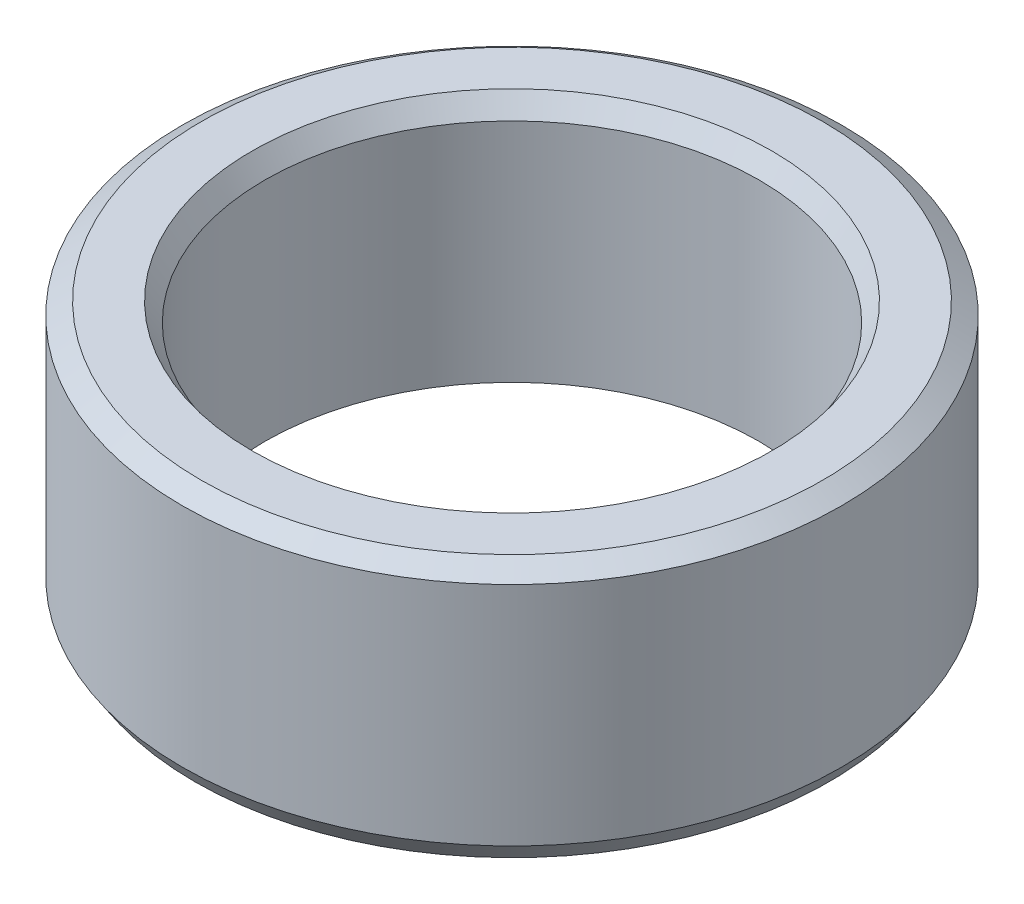
from build123d import *
from OCP.BRepFilletAPI import BRepFilletAPI_MakeChamfer

# Parameters (mm, degrees)
SKETCH1_R           = 45
BOSS_EXTRUDE1_DEPTH = 35.206088782
SKETCH2_R           = 33.75129709
CUT_EXTRUDE1_DEPTH  = 73.728733574
CHAMFER1_SIZE       = 1.714017891
CHAMFER1_SIZE2      = 2.590154728


with BuildPart() as part:
    # Sketch1 → Boss-Extrude1 (new body)
    with BuildSketch(Plane(origin=(0, 0, 0), x_dir=(1, 0, 0), z_dir=(0, 1, 0))):
        Circle(SKETCH1_R)
    extrude(amount=BOSS_EXTRUDE1_DEPTH)

    # Sketch2 → Cut-Extrude1 (cut, through all)
    with BuildSketch(Plane(origin=(0, 0, 0), x_dir=(1, 0, 0), z_dir=(0, 1, 0))):
        Circle(SKETCH2_R)
    extrude(amount=CUT_EXTRUDE1_DEPTH, mode=Mode.SUBTRACT)

    # Chamfer1: one chamfer whose edges measure the first distance from different faces: ONE call of the kernel's chamfer builder (chamfer() names one face for all edges)
    chamfer1_edges_1 = [part.edges().sort_by_distance(p)[0] for p in [
        (-33.75129709, 35.206088782, 0),
    ]]
    chamfer1_side_1 = [part.faces().sort_by_distance(p)[0] for p in [
        (-43.727207794, 35.206088782, 0),
    ]]
    chamfer1_edges_2 = [part.edges().sort_by_distance(p)[0] for p in [
        (-33.75129709, 0, 0),
    ]]
    chamfer1_side_2 = [part.faces().sort_by_distance(p)[0] for p in [
        (-33.75129709, 17.603044391, 0),
    ]]
    chamfer1_edges_3 = [part.edges().sort_by_distance(p)[0] for p in [
        (-45, 0, 0),
    ]]
    chamfer1_side_3 = [part.faces().sort_by_distance(p)[0] for p in [
        (-43.727207794, 0, 0),
    ]]
    chamfer1_edges_4 = [part.edges().sort_by_distance(p)[0] for p in [
        (-45, 35.206088782, 0),
    ]]
    chamfer1_side_4 = [part.faces().sort_by_distance(p)[0] for p in [
        (-45, 17.603044391, 0),
    ]]
    chamfer1 = BRepFilletAPI_MakeChamfer(part.part.solid().wrapped)
    for e in chamfer1_edges_1:
        chamfer1.Add(CHAMFER1_SIZE, CHAMFER1_SIZE2, e.wrapped, chamfer1_side_1[0].wrapped)  # the first distance lies on this face
    for e in chamfer1_edges_2:
        chamfer1.Add(CHAMFER1_SIZE, CHAMFER1_SIZE2, e.wrapped, chamfer1_side_2[0].wrapped)  # the first distance lies on this face
    for e in chamfer1_edges_3:
        chamfer1.Add(CHAMFER1_SIZE, CHAMFER1_SIZE2, e.wrapped, chamfer1_side_3[0].wrapped)  # the first distance lies on this face
    for e in chamfer1_edges_4:
        chamfer1.Add(CHAMFER1_SIZE, CHAMFER1_SIZE2, e.wrapped, chamfer1_side_4[0].wrapped)  # the first distance lies on this face
    add(Compound.cast(chamfer1.Shape()), mode=Mode.REPLACE)


solid = part.part
